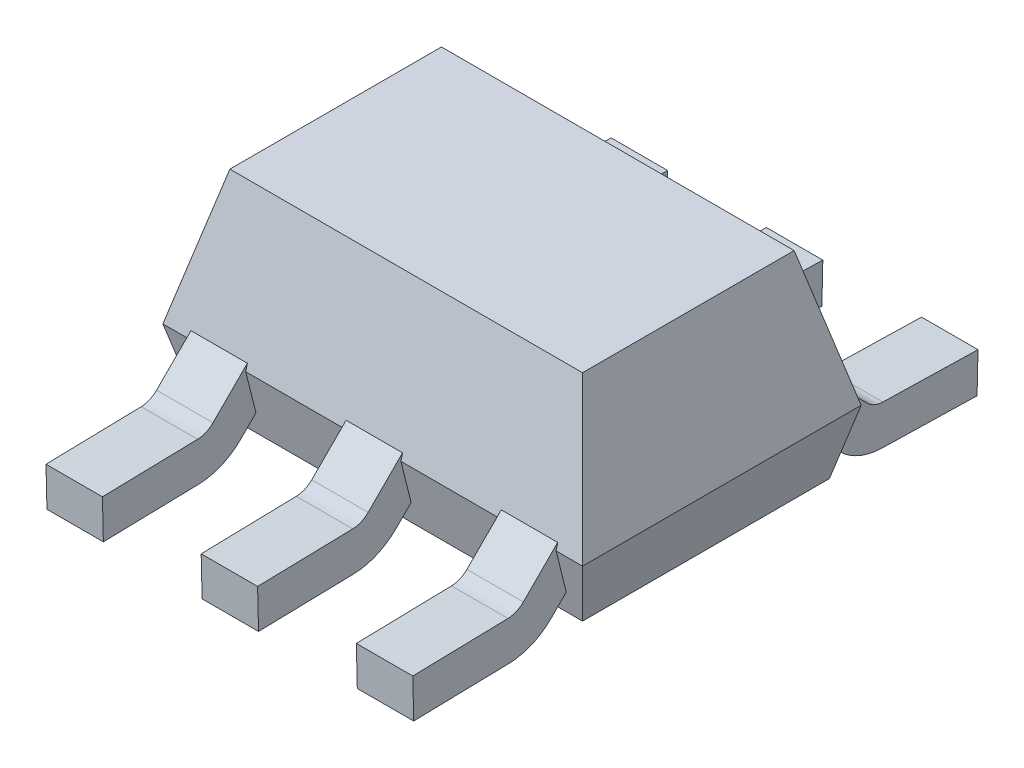
from build123d import *
from OCP.BRepFilletAPI import BRepFilletAPI_MakeChamfer

# Parameters (mm, degrees)
SKETCH1_W            = 3
SKETCH1_H            = 2
IC_DEPTH             = 1.4
IC_TC_SIZE           = 1
IC_TC_SIZE2          = 0.25
IC_BC_SIZE           = 0.125
IC_BC_SIZE_2         = 0.5
LEG_EXTRUDED_DEPTH   = 0.2
LEG_P_COUNT          = 2
LEG_P_PITCH          = 1.1
LEG_P_COL_COUNT      = 2
LEG_P_COL_PITCH      = 1.1
MIRROR1_COPY_1_DEPTH = 0.2
MIRROR1_COPY_2_DEPTH = 0.2


with BuildPart() as part:
    # Sketch1 → IC (new body)
    with BuildSketch(Plane(origin=(0, 0, 0), x_dir=(1, 0, 0), z_dir=(0, 1, 0))):
        Rectangle(SKETCH1_W, SKETCH1_H)
    extrude(amount=IC_DEPTH)

    # IC TC: one chamfer whose edges measure the first distance from different faces: ONE call of the kernel's chamfer builder (chamfer() names one face for all edges)
    ic_tc_edges_1 = [part.edges().sort_by_distance(p)[0] for p in [
        (1.5, 1.4, 0),
    ]]
    ic_tc_side_1 = [part.faces().sort_by_distance(p)[0] for p in [
        (1.5, 0.7, 0),
    ]]
    ic_tc_edges_2 = [part.edges().sort_by_distance(p)[0] for p in [
        (0, 1.4, -1),
    ]]
    ic_tc_side_2 = [part.faces().sort_by_distance(p)[0] for p in [
        (0, 0.7, -1),
    ]]
    ic_tc_edges_3 = [part.edges().sort_by_distance(p)[0] for p in [
        (-1.5, 1.4, 0),
    ]]
    ic_tc_side_3 = [part.faces().sort_by_distance(p)[0] for p in [
        (-1.5, 0.7, 0),
    ]]
    ic_tc_edges_4 = [part.edges().sort_by_distance(p)[0] for p in [
        (0, 1.4, 1),
    ]]
    ic_tc_side_4 = [part.faces().sort_by_distance(p)[0] for p in [
        (0, 0.7, 1),
    ]]
    ic_tc = BRepFilletAPI_MakeChamfer(part.part.solid().wrapped)
    for e in ic_tc_edges_1:
        ic_tc.Add(IC_TC_SIZE, IC_TC_SIZE2, e.wrapped, ic_tc_side_1[0].wrapped)  # the first distance lies on this face
    for e in ic_tc_edges_2:
        ic_tc.Add(IC_TC_SIZE, IC_TC_SIZE2, e.wrapped, ic_tc_side_2[0].wrapped)  # the first distance lies on this face
    for e in ic_tc_edges_3:
        ic_tc.Add(IC_TC_SIZE, IC_TC_SIZE2, e.wrapped, ic_tc_side_3[0].wrapped)  # the first distance lies on this face
    for e in ic_tc_edges_4:
        ic_tc.Add(IC_TC_SIZE, IC_TC_SIZE2, e.wrapped, ic_tc_side_4[0].wrapped)  # the first distance lies on this face
    add(Compound.cast(ic_tc.Shape()), mode=Mode.REPLACE)

    # IC BC
    # the kernel refuses this chamfer: 0.5, 0.125 mm, written as the material it takes off along each edge
    with BuildSketch(Plane(origin=(2.79856375, 0, 1), x_dir=(0, -0.1477835663365713, -0.9890197255468893), z_dir=(-1, 0, 0))) as ic_bc_piece_1:
        Polygon((IC_BC_SIZE * 0.989019725547, -IC_BC_SIZE * 0.147783566337), (-IC_BC_SIZE_2 * 0.147783566337, -IC_BC_SIZE_2 * 0.989019725547), (0, 0), align=None)
    extrude(amount=5.5971275, mode=Mode.SUBTRACT)
    with BuildSketch(Plane(origin=(-1.5, 0, 2.29856375), x_dir=(-0.00933861064031752, 0.9999563942249224, 0), z_dir=(0, 0, -1))) as ic_bc_piece_2:
        Polygon((IC_BC_SIZE_2 * 0.999956394225, IC_BC_SIZE_2 * 0.00933861064032), (-IC_BC_SIZE * 0.00933861064032, IC_BC_SIZE * 0.999956394225), (0, 0), align=None)
    extrude(amount=4.5971275, mode=Mode.SUBTRACT)
    with BuildSketch(Plane(origin=(-2.79856375, 0, -1), x_dir=(0, 0.9999563942249224, -0.00933861064031752), z_dir=(1, 0, 0))) as ic_bc_piece_3:
        Polygon((IC_BC_SIZE_2 * 0.999956394225, IC_BC_SIZE_2 * 0.00933861064032), (-IC_BC_SIZE * 0.00933861064032, IC_BC_SIZE * 0.999956394225), (0, 0), align=None)
    extrude(amount=5.5971275, mode=Mode.SUBTRACT)
    with BuildSketch(Plane(origin=(1.5, 0, -2.29856375), x_dir=(-0.9890197255468893, -0.1477835663365713, 0), z_dir=(0, 0, 1))) as ic_bc_piece_4:
        Polygon((IC_BC_SIZE * 0.989019725547, -IC_BC_SIZE * 0.147783566337), (-IC_BC_SIZE_2 * 0.147783566337, -IC_BC_SIZE_2 * 0.989019725547), (0, 0), align=None)
    extrude(amount=4.5971275, mode=Mode.SUBTRACT)

    # Sketch3 → LEG EXTRUDED (add, symmetric)
    with BuildSketch(Plane(origin=(0, 0, 0), x_dir=(0, 0, -1), z_dir=(1, 0, 0))):
        with BuildLine():
            Line((0, 0.41), (0.6, 0.41))
            ThreePointArc((0.6, 0.41), (0.661229349, 0.397820725), (0.713137085, 0.363137085))
            Line((0.713137085, 0.363137085), (1.021622695, 0.054651475))
            ThreePointArc((1.021622695, 0.054651475), (1.159600548, -0.038720464), (1.32240259, -0.074099863))
            Line((1.32240259, -0.074099863), (1.996707745, -0.089961284))
            Line((1.996707745, -0.089961284), (2.003292255, 0.189961284))
            Line((2.003292255, 0.189961284), (1.328987101, 0.205822705))
            ThreePointArc((1.328987101, 0.205822705), (1.269786359, 0.218687941), (1.219612594, 0.252641373))
            Line((1.219612594, 0.252641373), (0.911126984, 0.561126984))
            ThreePointArc((0.911126984, 0.561126984), (0.76838071, 0.656506994), (0.6, 0.69))
            Line((0.6, 0.69), (0, 0.69))
            Line((0, 0.69), (0, 0.41))
        make_face()
    leg_extruded = extrude(amount=LEG_EXTRUDED_DEPTH, both=True)

    # LEG P: LEG EXTRUDED ×2
    with Locations(*[(-i * LEG_P_PITCH, 0, 0) for i in range(1, LEG_P_COUNT)]):
        add(leg_extruded)

    # LEG P col: LEG EXTRUDED ×2
    with Locations(*[(i * LEG_P_COL_PITCH, 0, 0) for i in range(1, LEG_P_COL_COUNT)]):
        add(leg_extruded)

    # Mirror1: LEG EXTRUDED across plane
    add(leg_extruded.mirror(Plane.XY))

    # Mirror1 copy 1 sketch → Mirror1 copy 1 (add, symmetric)
    with BuildSketch(Plane(origin=(-1.1, 0, 0), x_dir=(0, 0, 1), z_dir=(1, 0, 0))):
        with BuildLine():
            Line((0, -0.41), (0.6, -0.41))
            ThreePointArc((0.6, -0.41), (0.661229349, -0.397820725), (0.713137085, -0.363137085))
            Line((0.713137085, -0.363137085), (1.021622695, -0.054651475))
            ThreePointArc((1.021622695, -0.054651475), (1.159600548, 0.038720464), (1.32240259, 0.074099863))
            Line((1.32240259, 0.074099863), (1.996707745, 0.089961284))
            Line((1.996707745, 0.089961284), (2.003292255, -0.189961284))
            Line((2.003292255, -0.189961284), (1.328987101, -0.205822705))
            ThreePointArc((1.328987101, -0.205822705), (1.269786359, -0.218687941), (1.219612594, -0.252641373))
            Line((1.219612594, -0.252641373), (0.911126984, -0.561126984))
            ThreePointArc((0.911126984, -0.561126984), (0.76838071, -0.656506994), (0.6, -0.69))
            Line((0.6, -0.69), (0, -0.69))
            Line((0, -0.69), (0, -0.41))
        make_face()
    extrude(amount=MIRROR1_COPY_1_DEPTH, both=True)

    # Mirror1 copy 2 sketch → Mirror1 copy 2 (add, symmetric)
    with BuildSketch(Plane(origin=(1.1, 0, 0), x_dir=(0, 0, 1), z_dir=(1, 0, 0))):
        with BuildLine():
            Line((0, -0.41), (0.6, -0.41))
            ThreePointArc((0.6, -0.41), (0.661229349, -0.397820725), (0.713137085, -0.363137085))
            Line((0.713137085, -0.363137085), (1.021622695, -0.054651475))
            ThreePointArc((1.021622695, -0.054651475), (1.159600548, 0.038720464), (1.32240259, 0.074099863))
            Line((1.32240259, 0.074099863), (1.996707745, 0.089961284))
            Line((1.996707745, 0.089961284), (2.003292255, -0.189961284))
            Line((2.003292255, -0.189961284), (1.328987101, -0.205822705))
            ThreePointArc((1.328987101, -0.205822705), (1.269786359, -0.218687941), (1.219612594, -0.252641373))
            Line((1.219612594, -0.252641373), (0.911126984, -0.561126984))
            ThreePointArc((0.911126984, -0.561126984), (0.76838071, -0.656506994), (0.6, -0.69))
            Line((0.6, -0.69), (0, -0.69))
            Line((0, -0.69), (0, -0.41))
        make_face()
    extrude(amount=MIRROR1_COPY_2_DEPTH, both=True)


solid = part.part
